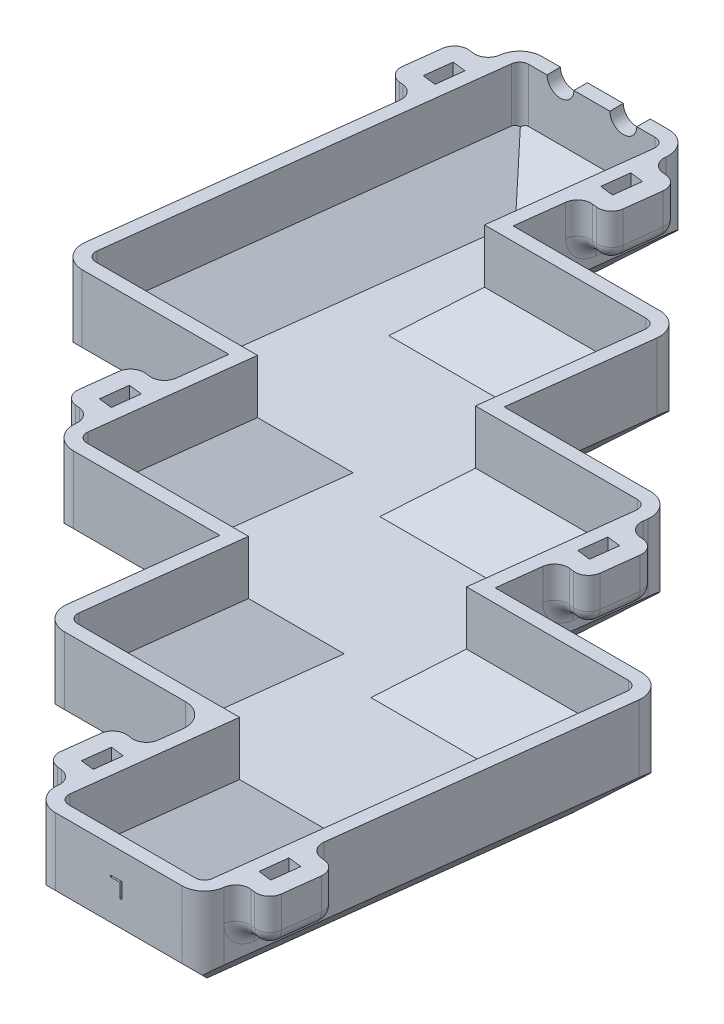
from build123d import *

# Parameters (mm, degrees)
BOSS_EXTRUDE1_DEPTH  = 25
CUT_EXTRUDE1_DEPTH   = 22
CHAMFER2_SIZE        = 10
FILLET4_R            = 5
FILLET5_R            = 2
BOSS_EXTRUDE7_DEPTH  = 7
BOSS_EXTRUDE8_DEPTH  = 7
BOSS_EXTRUDE10_DEPTH = 7
SKETCH22_W           = 14
SKETCH22_H           = 9.999999999999998
BOSS_EXTRUDE12_DEPTH = 7
SKETCH25_W           = 14.000000000000004
SKETCH25_H           = 10.000000000000002
BOSS_EXTRUDE13_DEPTH = 7
BOSS_EXTRUDE14_DEPTH = 7
CUT_EXTRUDE2_DEPTH   = 152.6147278280595
FILLET6_R            = 3
CUT_EXTRUDE3_DEPTH   = 1
SKETCH28_R           = 3.0000000000000018
CUT_EXTRUDE4_DEPTH   = 10


with BuildPart() as part:
    # Sketch1 → Boss-Extrude1 (new body)
    with BuildSketch(Plane(origin=(0, 0, 0), x_dir=(1, 0, 0), z_dir=(0, 1, 0))):
        Polygon((-13.500561150506945, 46.15659644527007), (24.78215759577686, 46.15659644527006), (13.500561150506956, -46.156596445270054), (-24.78215759577686, -46.15659644527006), align=None)
        Polygon((47.396477887067626, -82.05219881509004), (9.11375914078381, -82.05219881509004), (20.395355586053707, 10.260994075450109), (58.678074332337516, 10.260994075450107), align=None)
        Polygon((-47.396477887067626, 82.05219881509004), (-9.113759140783818, 82.05219881509004), (-20.395355586053707, -10.260994075450105), (-58.678074332337516, -10.260994075450107), align=None)
        Polygon((92.57399106889817, -25.63460829436987), (54.29127232261437, -25.634608294369855), (43.00967587734447, -117.94780118490999), (81.29239462362828, -117.94780118490999), align=None)
    extrude(amount=BOSS_EXTRUDE1_DEPTH)

    # Sketch4 → Cut-Extrude1 (cut)
    with BuildSketch(Plane(origin=(0, 25, 0), x_dir=(1, 0, 0), z_dir=(0, 1, 0))):
        Polygon((-21.393207657637884, -43.15659644527006), (16.889511088645914, -43.15659644527006), (12.502709078922813, -79.05219881509001), (50.785427825206526, -79.05219881509001), (46.39862581548338, -114.94780118490999), (78.63670475972245, -114.94780118490999), (89.18504113075916, -28.63460829436987), (50.90232238447545, -28.63460829436987), (55.28912439419861, 7.260994075450114), (17.006405647914704, 7.260994075450106), (21.39320765763789, 43.156596445270054), (-16.889511088645936, 43.15659644527006), (-12.502709078922724, 79.05219881509005), (-44.740788023161805, 79.05219881509004), (-55.28912439419852, -7.260994075450071), (-17.006405647914733, -7.2609940754500775), align=None)
    extrude(amount=-CUT_EXTRUDE1_DEPTH, mode=Mode.SUBTRACT)

    # Chamfer2
    chamfer2_edges = [part.edges().sort_by_distance(p)[0] for p in [
        (73.43263169575627, 0, 25.634608294369862),
        (86.93319284626322, 0, 71.79120473963994),
        (62.15103525048637, 0, 117.94780118490999),
        (45.20307688220605, 0, 100.00000000000001),
        (28.255118513925716, 0, 82.05219881509004),
        (11.307160145645387, 0, 64.10439763018005),
        (-5.640798222634951, 0, 46.156596445270054),
        (-22.58875659091528, 0, 28.208795260360088),
        (-39.536714959195606, 0, 10.260994075450107),
        (-53.037276109702574, 0, -35.89560236981996),
        (-28.255118513925723, 0, -82.05219881509004),
        (-11.307160145645394, 0, -64.10439763018005),
        (5.640798222634958, 0, -46.15659644527007),
        (22.58875659091528, 0, -28.208795260360084),
        (39.536714959195606, 0, -10.260994075450107),
        (56.48467332747594, 0, 7.686807109459874),
        (-50.01495620868016, 3, -35.89560236981998),
        (2.2518482844959777, 3, -43.15659644527006),
        (19.19980665277631, 3, -25.208795260360084),
        (36.14776502105666, 3, -7.26099407545011),
        (53.095723389337024, 3, 10.686807109459874),
        (70.0436817576173, 3, 28.63460829436987),
        (62.51766528760291, 3, 114.94780118490999),
        (48.592026820344955, 3, 97),
        (31.64406845206467, 3, 79.05219881509001),
        (-2.251848284495985, 3, 43.15659644527006),
        (-36.14776502105663, 3, 7.260994075450073),
        (-28.621748551042266, 3, -79.05219881509004),
        (-14.696110083784301, 3, -61.10439763018005),
        (83.91087294524081, 3, 71.79120473963994),
        (14.696110083784388, 3, 61.10439763018004),
        (-19.19980665277628, 3, 25.208795260360073),
    ]]
    chamfer(chamfer2_edges, length=CHAMFER2_SIZE)

    # Fillet4
    fillet4_edges = [part.edges().sort_by_distance(p)[0] for p in [
        (92.57399106889817, 17.5, 25.63460829436987),
        (81.29239462362828, 17.5, 117.94780118490999),
        (43.00967587734447, 17.5, 117.94780118490999),
        (47.396477887067626, 17.5, 82.05219881509004),
        (9.11375914078381, 17.5, 82.05219881509004),
        (-24.78215759577686, 17.5, 46.15659644527006),
        (-58.678074332337516, 17.5, 10.260994075450107),
        (-47.396477887067626, 17.5, -82.05219881509004),
        (-9.113759140783818, 17.5, -82.05219881509004),
        (24.78215759577686, 17.5, -46.15659644527006),
        (58.678074332337516, 17.5, -10.260994075450107),
    ]]
    fillet(fillet4_edges, radius=FILLET4_R)

    # Fillet5
    fillet5_edges = [part.edges().sort_by_distance(p)[0] for p in [
        (-44.740788023161805, 19, -79.05219881509004),
        (-12.502709078922726, 19, -79.05219881509005),
        (21.39320765763789, 19, -43.156596445270054),
        (55.28912439419861, 19, -7.260994075450114),
        (89.18504113075916, 19, 28.63460829436987),
        (78.63670475972245, 19, 114.94780118490999),
        (46.39862581548338, 19, 114.94780118490999),
        (12.502709078922813, 19, 79.05219881509001),
        (-21.393207657637884, 19, 43.15659644527006),
        (-55.28912439419852, 19, 7.26099407545007),
    ]]
    fillet(fillet5_edges, radius=FILLET5_R)

    # Sketch13 → Boss-Extrude7 (add)
    with BuildSketch(Plane(origin=(56.5790537071052, 0, 6.914526853552508), x_dir=(-0.12130748865881744, 0, 0.9926149773176359), z_dir=(-0.9926149773176359, 0, -0.12130748865881744))):
        Polygon((89.21110833221583, 15.000000000000002), (103.21110833221583, 15.000000000000002), (103.21110833221582, 25), (89.21110833221583, 25), align=None)
    extrude(amount=BOSS_EXTRUDE7_DEPTH)

    # Sketch14 → Boss-Extrude8 (add)
    with BuildSketch(Plane(origin=(-56.5790537071052, 0, -6.914526853552508), x_dir=(-0.12130748865881744, 0, 0.9926149773176359), z_dir=(-0.9926149773176359, 0, -0.12130748865881744))):
        Polygon((-54.270543988773134, 15.000000000000002), (-68.27054398877314, 14.999999999999998), (-68.27054398877314, 25), (-54.270543988773134, 25), align=None)
    extrude(amount=BOSS_EXTRUDE8_DEPTH)

    # Sketch16 → Boss-Extrude10 (add)
    with BuildSketch(Plane(origin=(-18.85968456903506, 0, -2.3048422845175067), x_dir=(0.12130748865881631, 0, -0.9926149773176361), z_dir=(0.9926149773176361, 0, 0.12130748865881631))):
        Polygon((71.6924243351946, 15.000000000000068), (57.6924243351946, 15.000000000000066), (57.6924243351946, 25), (71.6924243351946, 25), align=None)
    extrude(amount=BOSS_EXTRUDE10_DEPTH)

    # Sketch22 → Boss-Extrude12 (add)
    with BuildSketch(Plane(origin=(94.29842284517537, 0, 11.524211422587523), x_dir=(0.12130748865881616, 0, -0.9926149773176361), z_dir=(0.992614977317636, 0, 0.12130748865881615))):
        with Locations((-92.78922798579434, 20.000000000000004)):
            Rectangle(SKETCH22_W, SKETCH22_H)
    extrude(amount=BOSS_EXTRUDE12_DEPTH)

    # Sketch25 → Boss-Extrude13 (add)
    with BuildSketch(Plane(origin=(-18.85968456903506, 0, -2.3048422845175063), x_dir=(-0.12130748865881631, 0, 0.9926149773176361), z_dir=(-0.9926149773176361, 0, -0.12130748865881631))):
        with Locations((33.17374033817337, 20.000000000000004)):
            Rectangle(SKETCH25_W, SKETCH25_H)
    extrude(amount=BOSS_EXTRUDE13_DEPTH)

    # Sketch26 → Boss-Extrude14 (add)
    with BuildSketch(Plane(origin=(56.57905370710522, 0, 6.91452685355251), x_dir=(0.12130748865881609, 0, -0.9926149773176361), z_dir=(0.992614977317636, 0, 0.12130748865881608))):
        Polygon((-6.344943658847823, 15.000000000000002), (7.655056341152177, 15.000000000000002), (7.655056341152176, 25), (-6.344943658847824, 25), align=None)
    extrude(amount=BOSS_EXTRUDE14_DEPTH)

    # Sketch23 → Cut-Extrude2 (cut, through all)
    with BuildSketch(Plane(origin=(0, 25, 0), x_dir=(1, 0, 0), z_dir=(0, 1, 0))):
        Polygon((-51.76040035304405, 71.07435388313714), (-48.782555421091146, 70.7104314171607), (-49.51040035304404, 64.75474155325487), (-52.48824528499694, 65.11866401923132), align=None)
        Polygon((-10.64808657170565, 69.49735653057252), (-7.6702416397527395, 69.13343406459607), (-8.398086571705642, 63.17774420069025), (-11.375931503658542, 63.54166666666671), align=None)
        Polygon((-25.497830164855003, -27.28214183087024), (-22.5199852329021, -27.64606429684669), (-23.247830164855, -33.601754160752506), (-26.225675096807905, -33.237831694776055), align=None)
        Polygon((83.40631708960467, -100.65034392307486), (86.38416202155759, -101.0142663890513), (85.6563170896047, -106.9699562529571), (82.67847215765177, -106.60603378698066), align=None)
        Polygon((42.29400330826617, -99.07334657051018), (45.271848240219086, -99.43726903648664), (44.544003308266106, -105.39295890039244), (41.56615837631321, -105.029036434416), align=None)
        Polygon((57.022439412756846, -3.286463186385052), (60.000284344709755, -3.650385652361503), (59.27243941275686, -9.60607551626732), (56.29459448080395, -9.24215305029087), align=None)
    extrude(amount=-CUT_EXTRUDE2_DEPTH, mode=Mode.SUBTRACT)

    # Fillet6
    fillet6_edges = [part.edges().sort_by_distance(p)[0] for p in [
        (90.83985188546347, 20.000000000000007, 97.52903643441601),
        (89.99069946485176, 15.000000000000007, 104.47734127563945),
        (89.14154704424004, 20.000000000000004, 111.42564611686291),
        (-10.162856617070394, 20.000000000000036, -73.46781643984303),
        (-11.861161458293823, 20.000000000000032, -59.57120675739613),
        (-48.29732546645581, 20, -74.68089132643122),
        (-49.75301533036162, 15.000000000000002, -62.76951159861959),
        (-23.490445142172625, 15.000000000000002, 35.586984115387786),
        (45.7570781948544, 20, 95.46680912721608),
        (44.058773353630954, 20, 109.36341880966297),
        (83.64893206692238, 15.000000000000007, 98.66511396843958),
        (82.43585718033422, 15.000000000000005, 108.59126374161595),
        (-3.2145517758469406, 20.000000000000036, -72.61866401923132),
        (-6.6887041964586675, 15.000000000000068, -73.04324022953718),
        (-10.405471594388025, 15.000000000000068, -71.48258648520778),
        (-11.618546480976189, 15.000000000000066, -61.55643671203142),
        (-4.063704196458655, 15.000000000000068, -65.67035917800787),
        (-8.387009037682096, 15.000000000000066, -59.146630547090275),
        (-4.91285661707037, 20.000000000000032, -58.722054336784424),
        (-55.245630307679264, 20, -75.53004374704295),
        (-51.77147788706753, 14.999999999999998, -75.10546753673708),
        (-48.539940443773446, 14.999999999999998, -72.69566137179595),
        (-49.99563030767925, 20, -60.784281643984315),
        (-56.94393514890271, 20, -61.63343406459604),
        (-56.09478272829099, 15, -68.58173890581949),
        (-53.46978272829097, 15.000000000000002, -61.20885785429017),
        (-28.983060119490283, 20, 22.82645196696443),
        (-25.508907698878556, 15.000000000000002, 23.25102817727029),
        (-22.03475527826683, 20, 23.675604387576147),
        (-22.27737025558446, 15.000000000000002, 25.66083434221142),
        (-23.733060119490258, 20, 37.57221407002306),
        (-29.832212540102, 15.000000000000002, 29.774756808187888),
        (-30.68136496071371, 20, 36.72306164941134),
        (-27.207212540101985, 15.000000000000002, 37.1476378597172),
        (38.80877335363094, 20, 94.61765670660436),
        (42.28292577424268, 15.000000000000002, 95.04223291691022),
        (45.51446321753676, 15.000000000000002, 97.45203908185137),
        (44.30138833094859, 15.000000000000002, 107.37818885502772),
        (37.959620933019224, 15.000000000000002, 101.56596154782781),
        (37.1104685124075, 20, 108.51426638905126),
        (40.58462093301923, 15.000000000000002, 108.93884259935713),
        (83.89154704424003, 20.000000000000007, 96.6798840138043),
        (85.66739462362833, 15.000000000000005, 111.00106990655706),
        (82.1932422030166, 20.000000000000004, 110.5764936962512),
        (87.36569946485176, 15.000000000000007, 97.10446022411016),
        (55.80936452616871, 20, 13.212612959561422),
        (57.2650543900745, 15.000000000000002, 1.3012332317497837),
        (56.05197950348634, 15.000000000000002, 11.227383004926146),
        (59.28351694678043, 15.000000000000002, 13.637189169867279),
        (62.75766936739216, 20, 14.061765380173135),
        (63.60682178800388, 15.000000000000002, 7.113460538949681),
        (60.981821788003856, 15.000000000000002, -0.2594205125796281),
        (57.50766936739213, 20, -0.6839967228854844),
        (64.45597420861559, 20, 0.1651556977262283),
    ]]
    fillet(fillet6_edges, radius=FILLET6_R - 0.0001)  # a hair under: the kernel refuses the full size

    # Sketch27 → Cut-Extrude3 (cut)
    with BuildSketch(Plane.XY.offset(117.94780118490999)):
        Polygon((-0.8076923076923078, -3.5), (-1.4807692307692308, -3.5), (-1.4807692307692308, -0.358974358974359), (-4.173076923076923, -0.358974358974359), (-4.173076923076923, 0), (-0.8076923076923078, 0), align=None)
        Polygon((-0.6282051282051282, -3.5), (-1.121794871794872, -3.5), (-1.121794871794872, -0.358974358974359), (-3.1410256410256414, -0.358974358974359), (-3.1410256410256414, 0), (-0.6282051282051282, 0), align=None)
        Polygon((63.5070257112349, 15.603799357766857), (63.013435967645165, 15.603799357766857), (63.013435967645165, 18.744824998792495), (60.99420519841439, 18.744824998792495), (60.99420519841439, 19.103799357766857), (63.5070257112349, 19.103799357766857), align=None)
    extrude(amount=-CUT_EXTRUDE3_DEPTH, mode=Mode.SUBTRACT)

    # Sketch28 → Cut-Extrude4 (cut)
    with BuildSketch(Plane(origin=(0, 0, -82.05219881509004), x_dir=(-1, 0, 0), z_dir=(0, 0, -1))):
        with Locations((35.866168575786695, 25.000000000000004)):
            Circle(SKETCH28_R)
        with Locations((21.866168575786695, 25.000000000000004)):
            Circle(SKETCH28_R)
    extrude(amount=-CUT_EXTRUDE4_DEPTH, mode=Mode.SUBTRACT)


solid = part.part
